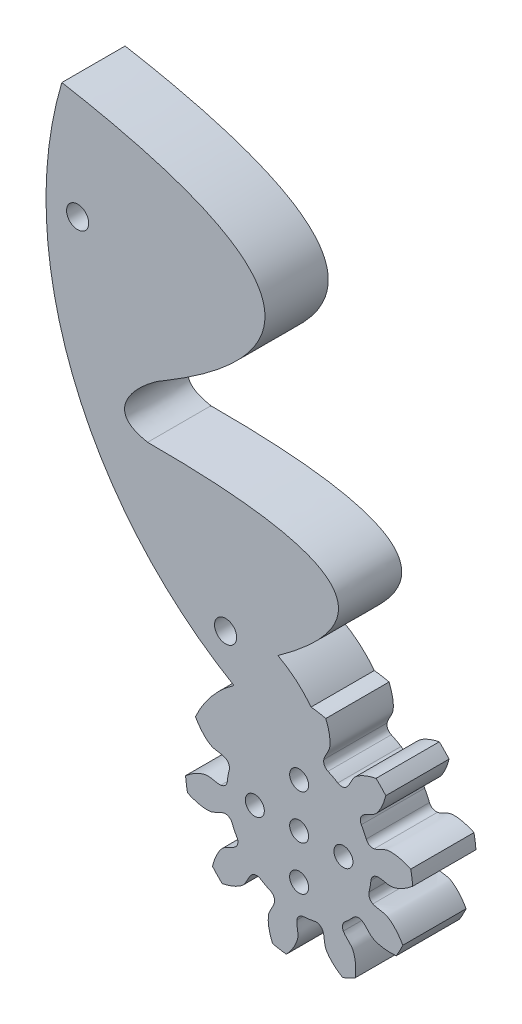
from build123d import *

# Parameters (mm, degrees)
SKETCH_1_R               = 5
SKETCH_1_R_2             = 1.75
EXTRUDE_1_DEPTH          = 1
SKETCH_1_2_R             = 5
SKETCH_1_2_R_2           = 1.75
EXTRUDE_1_2_DEPTH        = 10
SKETCH_3_R               = 18
EXTRUDE_2_DEPTH          = 10
CUT_EXTRUDE_1_DEPTH      = 10
SKETCH_4_R               = 1.5
CUT_EXTRUDE_2_DEPTH      = 10
PATTERN_CIRCULAR_1_COUNT = 8
PATTERN_CIRCULAR_1_ANGLE = 252


with BuildPart() as part:
    # 草图1 → Extrude 1 (new body)
    with BuildSketch(Plane.XY):
        with BuildLine():
            Line((-25, -57.052607302), (-25, -57.883306535))
            ThreePointArc((-25, -57.883306535), (-20.099106379, -76.543069457), (-14.829333353, -57.984109281))
            ThreePointArc((-14.829333353, -57.984109281), (-17.219408632, -49.939828574), (-23.352220135, -44.21169319))
            add(Edge.make_bspline(
                [(-43.945892315, -25.321121023), (3.201294067, -25.207766965), (-23.352220135, -44.21169319)],
                knots=[0, 0, 0, 1, 1, 1], degree=2))
            add(Edge.make_bspline(
                [(-41.474471887, -15.662713137), (-44.124609992, -17.053268876), (-52.241728052, -23.808134716), (-43.945892315, -25.321121023)],
                knots=[0, 0, 0, 0, 1, 1, 1, 1], degree=3))
            add(Edge.make_bspline(
                [(-57.499811424, 17.139769141), (-2.678837186, 7.425669673), (-41.474471887, -15.662713137)],
                knots=[0, 0, 0, 1, 1, 1], degree=2))
            ThreePointArc((-57.499811424, 17.139769141), (-55.136321326, -23.664024818), (-27.1875, -53.486819346))
            ThreePointArc((-27.1875, -53.486819346), (-25.590454576, -54.960957236), (-25, -57.052607302))
        make_face()
        with Locations((-20, -66.543560573)):
            Circle(SKETCH_1_R, mode=Mode.SUBTRACT)
        with Locations((-31.620079453, -45.001895242)):
            Circle(SKETCH_1_R_2, mode=Mode.SUBTRACT)
        with Locations((-55, 0)):
            Circle(SKETCH_1_R_2, mode=Mode.SUBTRACT)
    extrude(amount=EXTRUDE_1_DEPTH)

    # 草图1<2> → Extrude 1 2 (add)
    with BuildSketch(Plane.XY):
        with BuildLine():
            Line((-25, -57.052607302), (-25, -57.883306535))
            ThreePointArc((-25, -57.883306535), (-20.099106379, -76.543069457), (-14.829333353, -57.984109281))
            ThreePointArc((-14.829333353, -57.984109281), (-17.219408632, -49.939828574), (-23.352220135, -44.21169319))
            add(Edge.make_bspline(
                [(-43.945892315, -25.321121023), (3.201294067, -25.207766965), (-23.352220135, -44.21169319)],
                knots=[0, 0, 0, 1, 1, 1], degree=2))
            add(Edge.make_bspline(
                [(-41.474471887, -15.662713137), (-44.124609992, -17.053268876), (-52.241728052, -23.808134716), (-43.945892315, -25.321121023)],
                knots=[0, 0, 0, 0, 1, 1, 1, 1], degree=3))
            add(Edge.make_bspline(
                [(-57.499811424, 17.139769141), (-2.678837186, 7.425669673), (-41.474471887, -15.662713137)],
                knots=[0, 0, 0, 1, 1, 1], degree=2))
            ThreePointArc((-57.499811424, 17.139769141), (-55.136321326, -23.664024818), (-27.1875, -53.486819346))
            ThreePointArc((-27.1875, -53.486819346), (-25.590454576, -54.960957236), (-25, -57.052607302))
        make_face()
        with Locations((-20, -66.543560573)):
            Circle(SKETCH_1_2_R, mode=Mode.SUBTRACT)
        with Locations((-31.620079453, -45.001895242)):
            Circle(SKETCH_1_2_R_2, mode=Mode.SUBTRACT)
        with Locations((-55, 0)):
            Circle(SKETCH_1_2_R_2, mode=Mode.SUBTRACT)
    extrude(amount=EXTRUDE_1_2_DEPTH)

    # 草图3 → 凸台-拉伸2 (add)
    with BuildSketch(Plane.XY.offset(10)):
        with Locations((-20, -66.543560573)):
            Circle(SKETCH_3_R)
    extrude(amount=-EXTRUDE_2_DEPTH)

    # 草图2 → 切除-拉伸1 (cut)
    with BuildSketch(Plane.XY.offset(10)):
        with BuildLine():
            ThreePointArc((-31.0411552, -63.705798804), (-31.226808384, -64.563971348), (-31.345863753, -65.433886883))
            ThreePointArc((-31.345863753, -65.433886883), (-31.674685887, -66.129358593), (-32.370432631, -66.457598389))
            add(Edge.make_bspline(
                [(-32.370432631, -66.457598389), (-33.082490815, -66.526638944), (-33.858961448, -66.163966099), (-34.665803394, -66.228145213), (-34.782772104, -66.246467902), (-34.875458843, -66.263671387), (-34.98170752, -66.286974208), (-35.101238614, -66.317128094), (-35.23370224, -66.355031137), (-35.378717053, -66.401514137), (-35.535858453, -66.457407541), (-35.704663235, -66.523517964), (-35.88462912, -66.600633307), (-36.075215977, -66.68951903), (-36.275846598, -66.790917178), (-36.485907704, -66.905544623), (-36.704750952, -67.034091586), (-36.931694028, -67.177220128), (-37.166021788, -67.335562701), (-37.406987462, -67.509720747), (-37.65381391, -67.700263333), (-37.905694935, -67.907725849), (-38.161796644, -68.132608727), (-38.421258867, -68.375376314), (-38.683196615, -68.636455412), (-39.041165649, -69.016533897), (-39.300396044, -69.319841307), (-39.469919447, -69.530868537)],
                knots=[0.111785707, 0.111785707, 0.111785707, 0.111785707, 0.344235796, 0.363717055, 0.372294399, 0.382431261, 0.394127639, 0.407383534, 0.422198946, 0.438573875, 0.456508321, 0.476002284, 0.497055764, 0.519668761, 0.543841274, 0.569573305, 0.596864853, 0.625715918, 0.6561265, 0.688096598, 0.721626214, 0.756715347, 0.793363997, 0.831572163, 0.871339847, 0.912667048, 1, 1, 1, 1], degree=3))
            ThreePointArc((-39.469919447, -69.530868537), (-39.398507343, -63.123080343), (-37.274020134, -57.077304684))
            add(Edge.make_bspline(
                [(-31.653805058, -62.393401462), (-32.299307618, -62.084986319), (-33.152992761, -62.160218719), (-33.889225634, -61.823953881), (-33.992873539, -61.76673053), (-34.074086645, -61.718863811), (-34.165957709, -61.660627134), (-34.267966959, -61.591409708), (-34.379478447, -61.510487269), (-34.499849674, -61.417209551), (-34.628397618, -61.310941407), (-34.764411129, -61.191083294), (-34.907148743, -61.057066618), (-35.055841099, -60.908356816), (-35.209692004, -60.744454011), (-35.36787998, -60.564894317), (-35.529559714, -60.369250885), (-35.693863604, -60.157134947), (-35.859903321, -59.928196785), (-36.026771427, -59.682126641), (-36.193543016, -59.418655561), (-36.359277397, -59.137556182), (-36.523019809, -58.838643458), (-36.683803141, -58.52177524), (-36.840649799, -58.186853153), (-37.04703616, -57.707263585), (-37.186895807, -57.333585833), (-37.274020134, -57.077304684)],
                knots=[0.111785707, 0.111785707, 0.111785707, 0.111785707, 0.344235796, 0.363717055, 0.372294399, 0.382431261, 0.394127639, 0.407383534, 0.422198946, 0.438573875, 0.456508321, 0.476002284, 0.497055764, 0.519668761, 0.543841274, 0.569573305, 0.596864853, 0.625715918, 0.6561265, 0.688096598, 0.721626214, 0.756715347, 0.793363997, 0.831572163, 0.871339847, 0.912667048, 1, 1, 1, 1], degree=3))
            ThreePointArc((-31.653805058, -62.393401462), (-31.112281599, -62.939805377), (-31.0411552, -63.705798804))
        make_face()
    cut_extrude_1 = extrude(amount=-CUT_EXTRUDE_1_DEPTH, mode=Mode.SUBTRACT)

    # 草图4 → 切除-拉伸2 (cut)
    with BuildSketch(Plane.XY.offset(10)):
        with Locations((-20, -66.543560573)):
            Circle(SKETCH_4_R)
        with Locations((-20, -59.543560573)):
            Circle(SKETCH_4_R)
        with Locations((-13, -66.543560573)):
            Circle(SKETCH_4_R)
        with Locations((-20, -73.543560573)):
            Circle(SKETCH_4_R)
        with Locations((-27, -66.543560573)):
            Circle(SKETCH_4_R)
    extrude(amount=-CUT_EXTRUDE_2_DEPTH, mode=Mode.SUBTRACT)

    # 阵列(圆周)1: 切除-拉伸1 ×8 about axis
    pattern_circular_1_axis = Axis((-20, -66.543560573, 0), (0, 0, 1))
    for i in range(1, PATTERN_CIRCULAR_1_COUNT):
        add(cut_extrude_1.rotate(pattern_circular_1_axis, i * PATTERN_CIRCULAR_1_ANGLE / (PATTERN_CIRCULAR_1_COUNT - 1)), mode=Mode.SUBTRACT)


solid = part.part
